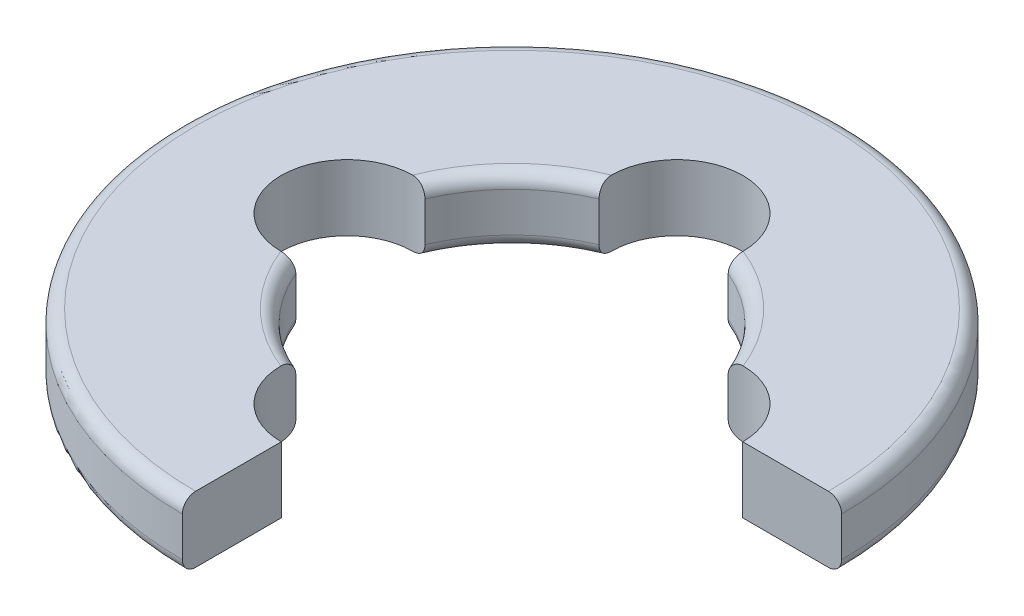
from build123d import *

# Parameters (mm, degrees)
BOSS_EXTRUDE1_DEPTH      = 0.25
BOSS_EXTRUDE1_DEPTH_BACK = 0.25
FILLET1_R                = 0.1


with BuildPart() as part:
    # Sketch1 → Boss-Extrude1 (new, two sides: drawn at the far end of the back side and taken through both)
    with BuildSketch(Plane(origin=(0, 0, 0), x_dir=(1, 0, 0), z_dir=(0, 1, 0)).offset(-BOSS_EXTRUDE1_DEPTH_BACK)):
        with BuildLine():
            Line((0, -1.75), (0, -2.5))
            ThreePointArc((0, -2.5), (-1.767766953, 1.767766953), (2.5, 0))
            Line((2.5, 0), (1.75, 0))
            ThreePointArc((1.75, 0), (1.566227766, 0.387298335), (1.15, 0.489897949))
            ThreePointArc((1.15, 0.489897949), (0.883883476, 0.883883476), (0.489897949, 1.15))
            ThreePointArc((0.489897949, 1.15), (0, 1.75), (-0.489897949, 1.15))
            ThreePointArc((-0.489897949, 1.15), (-0.883883476, 0.883883476), (-1.15, 0.489897949))
            ThreePointArc((-1.15, 0.489897949), (-1.75, 0), (-1.15, -0.489897949))
            ThreePointArc((-1.15, -0.489897949), (-0.883883476, -0.883883476), (-0.489897949, -1.15))
            ThreePointArc((-0.489897949, -1.15), (-0.387298335, -1.566227766), (0, -1.75))
        make_face()
    extrude(amount=BOSS_EXTRUDE1_DEPTH + BOSS_EXTRUDE1_DEPTH_BACK)

    # Fillet1
    # the kernel refuses this fillet: 0.1 mm, written as the material it takes off along each edge
    with BuildSketch(Plane(origin=(0, -0.25, 0), x_dir=(0.10019395208705734, 0, 0.9949679250936567), z_dir=(0.9949679250936567, 0, -0.10019395208705734))) as fillet1_piece_1:
        with BuildLine():
            CenterArc((2.5 - FILLET1_R, -FILLET1_R), FILLET1_R, 0, 90)
            Line((2.5 - FILLET1_R, 0), (2.5, 0))
            Line((2.5, 0), (2.5, -FILLET1_R))
        make_face()
    revolve(axis=Axis((0, -0.25, 0), (0, -1, 0)), revolution_arc=281.500678412, mode=Mode.SUBTRACT)
    with BuildSketch(Plane(origin=(0, -0.25, 0), x_dir=(-0.9795272488285965, 0, 0.2013116211307253), z_dir=(-0.2013116211307253, 0, -0.9795272488285965))) as fillet1_piece_2:
        with BuildLine():
            CenterArc((1.25 + FILLET1_R, FILLET1_R), FILLET1_R, 180, 90)
            Line((1.25 + FILLET1_R, 0), (1.25, 0))
            Line((1.25, 0), (1.25, FILLET1_R))
        make_face()
    revolve(axis=Axis((0, -0.25, 0), (0, 1, 0)), revolution_arc=66.772660904, mode=Mode.SUBTRACT)
    with BuildSketch(Plane(origin=(0, -0.25, 0), x_dir=(-0.20131162113072518, 0, -0.9795272488285967), z_dir=(0.9795272488285967, 0, -0.20131162113072518))) as fillet1_piece_3:
        with BuildLine():
            CenterArc((1.25 + FILLET1_R, FILLET1_R), FILLET1_R, 180, 90)
            Line((1.25 + FILLET1_R, 0), (1.25, 0))
            Line((1.25, 0), (1.25, FILLET1_R))
        make_face()
    revolve(axis=Axis((0, -0.25, 0), (0, 1, 0)), revolution_arc=66.772660904, mode=Mode.SUBTRACT)
    with BuildSketch(Plane(origin=(0, 0.25, 0), x_dir=(0.10019395208705734, 0, 0.9949679250936567), z_dir=(0.9949679250936567, 0, -0.10019395208705734))) as fillet1_piece_4:
        with BuildLine():
            CenterArc((2.5 - FILLET1_R, FILLET1_R), FILLET1_R, 270, 90)
            Line((2.5 - FILLET1_R, 0), (2.5, 0))
            Line((2.5, 0), (2.5, FILLET1_R))
        make_face()
    revolve(axis=Axis((0, 0.25, 0), (0, -1, 0)), revolution_arc=281.500678412, mode=Mode.SUBTRACT)
    with BuildSketch(Plane(origin=(0, 0.25, 0), x_dir=(-0.9795272488285965, 0, 0.2013116211307253), z_dir=(-0.2013116211307253, 0, -0.9795272488285965))) as fillet1_piece_5:
        with BuildLine():
            CenterArc((1.25 + FILLET1_R, -FILLET1_R), FILLET1_R, 90, 90)
            Line((1.25 + FILLET1_R, 0), (1.25, 0))
            Line((1.25, 0), (1.25, -FILLET1_R))
        make_face()
    revolve(axis=Axis((0, 0.25, 0), (0, 1, 0)), revolution_arc=66.772660904, mode=Mode.SUBTRACT)
    with BuildSketch(Plane(origin=(0, 0.25, 0), x_dir=(-0.20131162113072518, 0, -0.9795272488285967), z_dir=(0.9795272488285967, 0, -0.20131162113072518))) as fillet1_piece_6:
        with BuildLine():
            CenterArc((1.25 + FILLET1_R, -FILLET1_R), FILLET1_R, 90, 90)
            Line((1.25 + FILLET1_R, 0), (1.25, 0))
            Line((1.25, 0), (1.25, -FILLET1_R))
        make_face()
    revolve(axis=Axis((0, 0.25, 0), (0, 1, 0)), revolution_arc=66.772660904, mode=Mode.SUBTRACT)
    with BuildSketch(Plane(origin=(0, 0.25, 0), x_dir=(0.9795272488285964, 0, -0.20131162113072643), z_dir=(0.20131162113072643, 0, 0.9795272488285964))) as fillet1_piece_7:
        with BuildLine():
            CenterArc((1.25 + FILLET1_R, -FILLET1_R), FILLET1_R, 90, 90)
            Line((1.25 + FILLET1_R, 0), (1.25, 0))
            Line((1.25, 0), (1.25, -FILLET1_R))
        make_face()
    revolve(axis=Axis((0, 0.25, 0), (0, 1, 0)), revolution_arc=66.772660904, mode=Mode.SUBTRACT)
    with BuildSketch(Plane(origin=(0, -0.25, 0), x_dir=(0.9795272488285964, 0, -0.20131162113072643), z_dir=(0.20131162113072643, 0, 0.9795272488285964))) as fillet1_piece_8:
        with BuildLine():
            CenterArc((1.25 + FILLET1_R, FILLET1_R), FILLET1_R, 180, 90)
            Line((1.25 + FILLET1_R, 0), (1.25, 0))
            Line((1.25, 0), (1.25, FILLET1_R))
        make_face()
    revolve(axis=Axis((0, -0.25, 0), (0, 1, 0)), revolution_arc=66.772660904, mode=Mode.SUBTRACT)


solid = part.part
